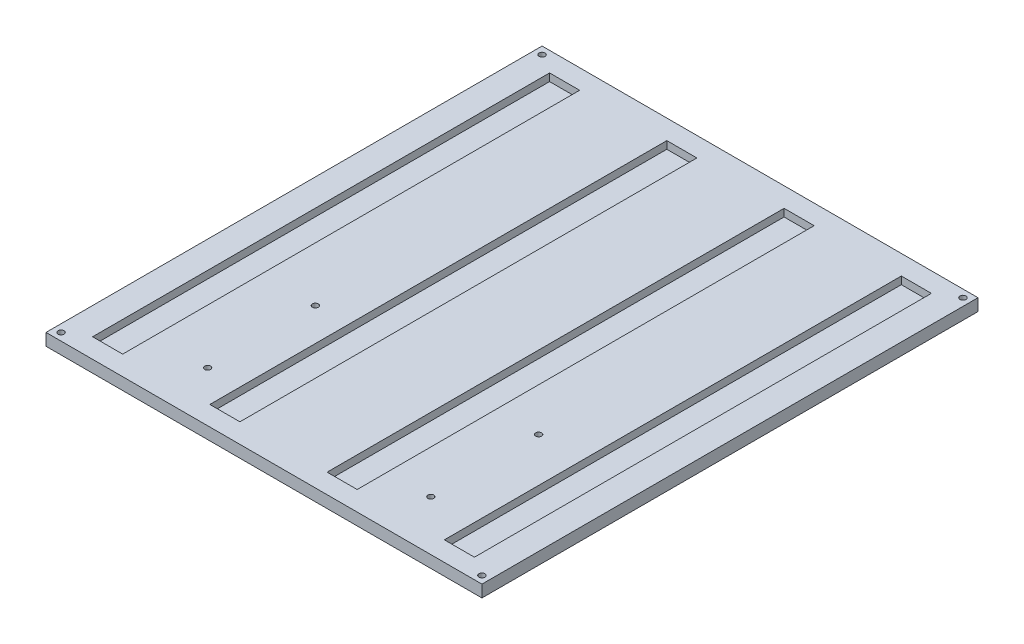
from build123d import *

# Parameters (mm, degrees)
SKETCH2_W           = 145
SKETCH2_H           = 165
BOSS_EXTRUDE1_DEPTH = 4
SKETCH2_3_W         = 10
SKETCH2_3_H         = 152
CUT_EXTRUDE1_DEPTH  = 2.5
SKETCH3_R           = 1
CUT_EXTRUDE3_DEPTH  = 5
SKETCH5_R           = 0.98
CUT_EXTRUDE4_DEPTH  = 4


with BuildPart() as part:
    # Sketch2 → Boss-Extrude1 (new body)
    with BuildSketch(Plane(origin=(0, 0, 0), x_dir=(1, 0, 0), z_dir=(0, 1, 0))):
        Rectangle(SKETCH2_W, SKETCH2_H)
    extrude(amount=-BOSS_EXTRUDE1_DEPTH)

    # Sketch2<3> → Cut-Extrude1 (cut)
    with BuildSketch(Plane(origin=(0, 0, 0), x_dir=(1, 0, 0), z_dir=(0, 1, 0))):
        with Locations((-19.5, 0)):
            Rectangle(SKETCH2_3_W, SKETCH2_3_H)
        with Locations((-58.5, 0)):
            Rectangle(SKETCH2_3_W, SKETCH2_3_H)
        with Locations((19.5, 0)):
            Rectangle(SKETCH2_3_W, SKETCH2_3_H)
        with Locations((58.5, 0)):
            Rectangle(SKETCH2_3_W, SKETCH2_3_H)
    extrude(amount=-CUT_EXTRUDE1_DEPTH, mode=Mode.SUBTRACT)

    # Sketch3 → Cut-Extrude3 (cut)
    with BuildSketch(Plane.XZ.offset(4)):
        with Locations((-70, 80)):
            Circle(SKETCH3_R)
        with Locations((70, 80)):
            Circle(SKETCH3_R)
        with Locations((70, -80)):
            Circle(SKETCH3_R)
        with Locations((-70, -80)):
            Circle(SKETCH3_R)
    extrude(amount=-CUT_EXTRUDE3_DEPTH, mode=Mode.SUBTRACT)

    # Sketch5 → Cut-Extrude4 (cut)
    with BuildSketch(Plane(origin=(0, -4, 0), x_dir=(1, 0, 0), z_dir=(0, 1, 0))):
        with Locations((-35.438735521, -29.971809351)):
            Circle(SKETCH5_R)
        with Locations((38.831264479, -29.971809351)):
            Circle(SKETCH5_R)
        with Locations((38.831264479, -65.811809351)):
            Circle(SKETCH5_R)
        with Locations((-35.438735521, -65.811809351)):
            Circle(SKETCH5_R)
    extrude(amount=CUT_EXTRUDE4_DEPTH, mode=Mode.SUBTRACT)


solid = part.part
